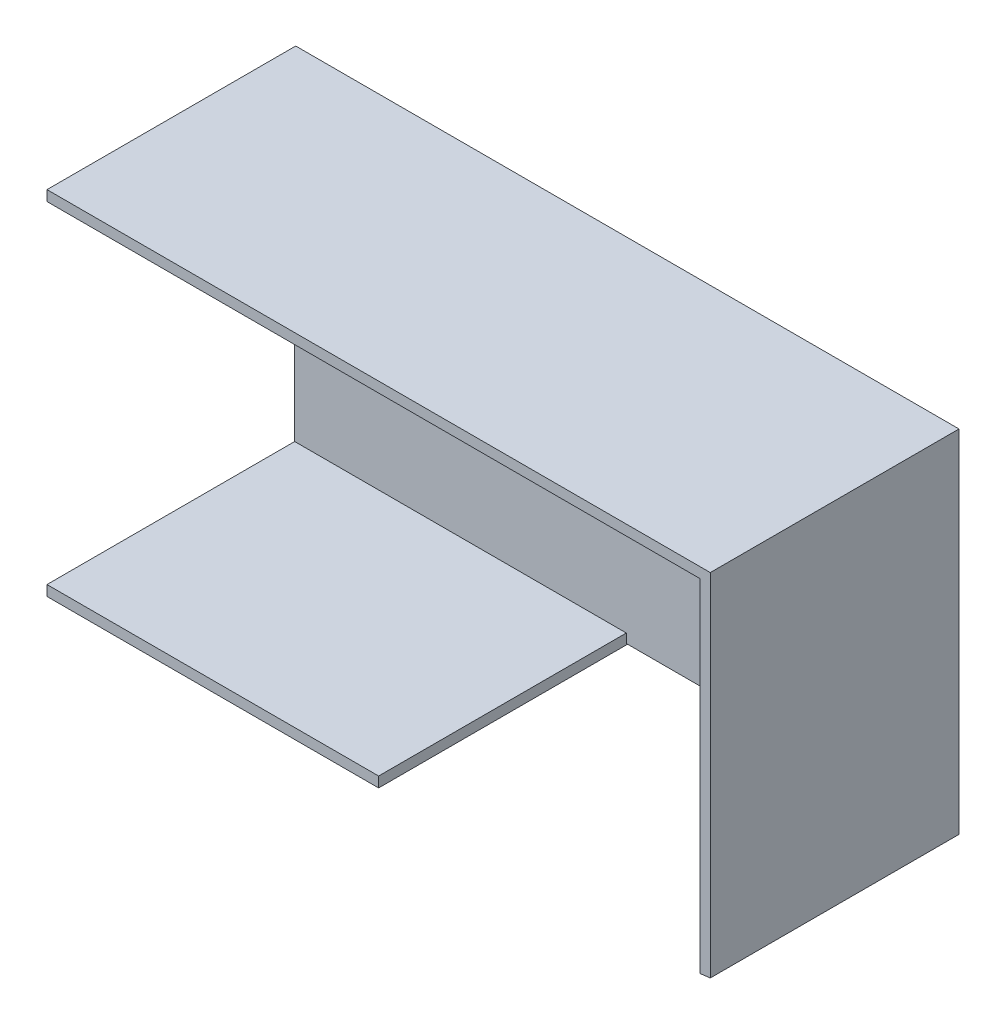
from build123d import *

# Parameters (mm, degrees)
BOSS_EXTRUDE1_DEPTH   = 152.4
SKETCH1_W             = 203.2
SKETCH1_H             = 6.35
BOSS_EXTRUDE1_2_DEPTH = 152.4
SKETCH3_W             = 406.4
SKETCH3_H             = 215.132857965
BOSS_EXTRUDE2_DEPTH   = 0.635


with BuildPart() as part:
    # Sketch1 → Boss-Extrude1 (new body)
    with BuildSketch(Plane.XY):
        Polygon((0, 6.35), (0, 0), (400.096509451, 0), (400.096509451, -209.55), (406.4, -208.782857965), (406.4, 6.35), align=None)
    extrude(amount=BOSS_EXTRUDE1_DEPTH)



with BuildPart() as body_2:
    # Sketch1 → Boss-Extrude1 2 (new body)
    with BuildSketch(Plane.XY):
        with Locations((101.6, -206.375)):
            Rectangle(SKETCH1_W, SKETCH1_H)
    extrude(amount=BOSS_EXTRUDE1_2_DEPTH)


with BuildPart() as part_1:
    add(part.part)

    add(body_2.part)  # Boss-Extrude2 merges body 2
    # Sketch3 → Boss-Extrude2 (add)
    with BuildSketch(Plane(origin=(0, 0, 0), x_dir=(-1, 0, 0), z_dir=(0, 0, -1))):
        with Locations((-203.2, -101.216428983)):
            Rectangle(SKETCH3_W, SKETCH3_H)
    extrude(amount=-BOSS_EXTRUDE2_DEPTH)


solid = part_1.part
